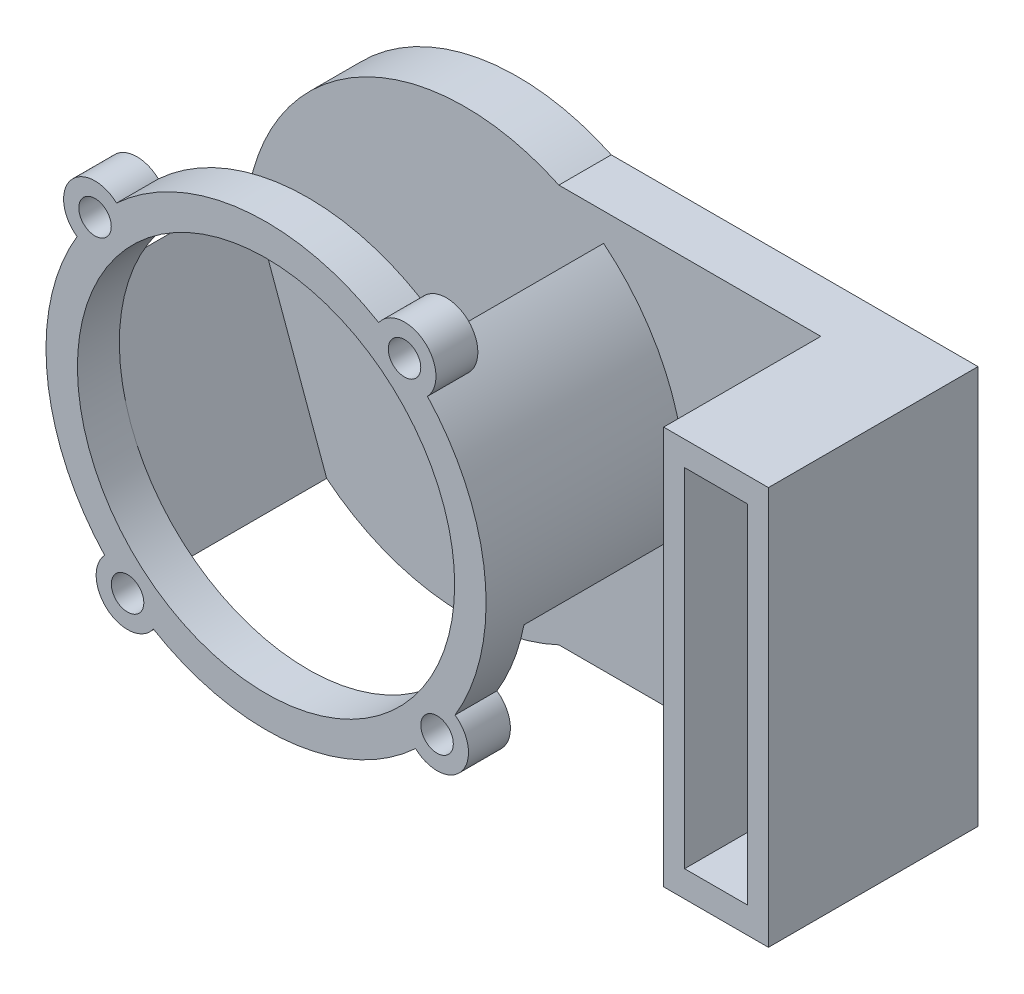
from build123d import *

# Parameters (mm, degrees)
ESTRUSIONE_ESTRUSIONE1_DEPTH = 2.5
SCHIZZO2_W                   = 10
SCHIZZO2_H                   = 38
ESTRUSIONE_ESTRUSIONE2_DEPTH = 15
SCHIZZO3_W                   = 6
SCHIZZO3_H                   = 33.15
TAGLIO_ESTRUSIONE1_DEPTH     = 13
ESTRUSIONE_SOTTILE1_START    = 19
SCHIZZO5_R                   = 21
SCHIZZO5_R_2                 = 18
ESTRUSIONE_SOTTILE1_DEPTH    = 19
SCHIZZO8_W                   = 36
SCHIZZO8_H                   = 15
TAGLIO_ESTRUSIONE2_DEPTH     = 70.157520353
SCHIZZO10_R                  = 3
ESTRUSIONE_ESTRUSIONE3_DEPTH = 4
FORO_PER_VITE_M2_5_1_D       = 3.1
FORO_PER_VITE_M2_5_1_DEPTH   = 3
FORO_PER_VITE_M2_5_1_TIP     = 0.931333959


with BuildPart() as part:
    # Schizzo1 → Estrusione-Estrusione1 (new, symmetric)
    with BuildSketch(Plane.XY):
        with BuildLine():
            Line((12.36549987, -26.390648792), (47.36549987, -26.390648792))
            Line((47.36549987, -26.390648792), (47.36549987, 11.609351208))
            Line((47.36549987, 11.609351208), (12.36549987, 11.609351208))
            ThreePointArc((12.36549987, 11.609351208), (-17.57877204, -7.390648792), (12.36549987, -26.390648792))
        make_face()
    extrude(amount=ESTRUSIONE_ESTRUSIONE1_DEPTH, both=True)

    # Schizzo2 → Estrusione-Estrusione2 (add)
    with BuildSketch(Plane.XY.offset(2.5)):
        with Locations((42.36549987, -7.390648792)):
            Rectangle(SCHIZZO2_W, SCHIZZO2_H)
    extrude(amount=ESTRUSIONE_ESTRUSIONE2_DEPTH)

    # Schizzo3 → Taglio-Estrusione1 (cut)
    with BuildSketch(Plane.XY.offset(17.5)):
        with Locations((42.36549987, -7.315648792)):
            Rectangle(SCHIZZO3_W, SCHIZZO3_H)
    extrude(amount=-TAGLIO_ESTRUSIONE1_DEPTH, mode=Mode.SUBTRACT)

    # Schizzo5 → Estrusione-Sottile1 (add)
    with BuildSketch(Plane.XY.offset(2.5).offset(ESTRUSIONE_SOTTILE1_START)):
        with Locations((3.42122796, -7.390648792)):
            Circle(SCHIZZO5_R)
        with Locations((3.42122796, -7.390648792)):
            Circle(SCHIZZO5_R_2, mode=Mode.SUBTRACT)
    extrude(amount=-ESTRUSIONE_SOTTILE1_DEPTH)

    # Schizzo8 → Taglio-Estrusione2 (cut, through all)
    with BuildSketch(Plane(origin=(-4.406906628, 12.10787645, 0), x_dir=(0.9396926207859102, 0.3420201433256638, 0), z_dir=(-0.3420201433256638, 0.9396926207859102, 0))):
        with Locations((0.687151909, -10)):
            Rectangle(SCHIZZO8_W, SCHIZZO8_H)
    extrude(amount=-TAGLIO_ESTRUSIONE2_DEPTH, mode=Mode.SUBTRACT)

    # Schizzo10 → Estrusione-Estrusione3 (add)
    with BuildSketch(Plane.XY.offset(21.5)):
        with Locations((-12.899464402, 5.82430489)):
            Circle(SCHIZZO10_R)
        with Locations((16.636181642, 8.93004357)):
            Circle(SCHIZZO10_R)
        with Locations((19.741920322, -20.605602474)):
            Circle(SCHIZZO10_R)
        with Locations((-9.793725722, -23.711341154)):
            Circle(SCHIZZO10_R)
    extrude(amount=-ESTRUSIONE_ESTRUSIONE3_DEPTH)

    # Foro per Vite M2.5-1
    with Locations(Plane(origin=(16.636181642, 8.93004357, 21.5), x_dir=(1, 0, 0), z_dir=(0, 0, 1))):
        with Locations((0, 0), (3.10573868, -29.535646044), (-26.429907364, -32.641384724), (-29.535646044, -3.10573868)):
            Hole(FORO_PER_VITE_M2_5_1_D / 2, depth=FORO_PER_VITE_M2_5_1_DEPTH)
            with Locations((0, 0, -(FORO_PER_VITE_M2_5_1_DEPTH + FORO_PER_VITE_M2_5_1_TIP / 2))):  # 118° drill point
                Cone(0, FORO_PER_VITE_M2_5_1_D / 2, FORO_PER_VITE_M2_5_1_TIP, mode=Mode.SUBTRACT)


solid = part.part
